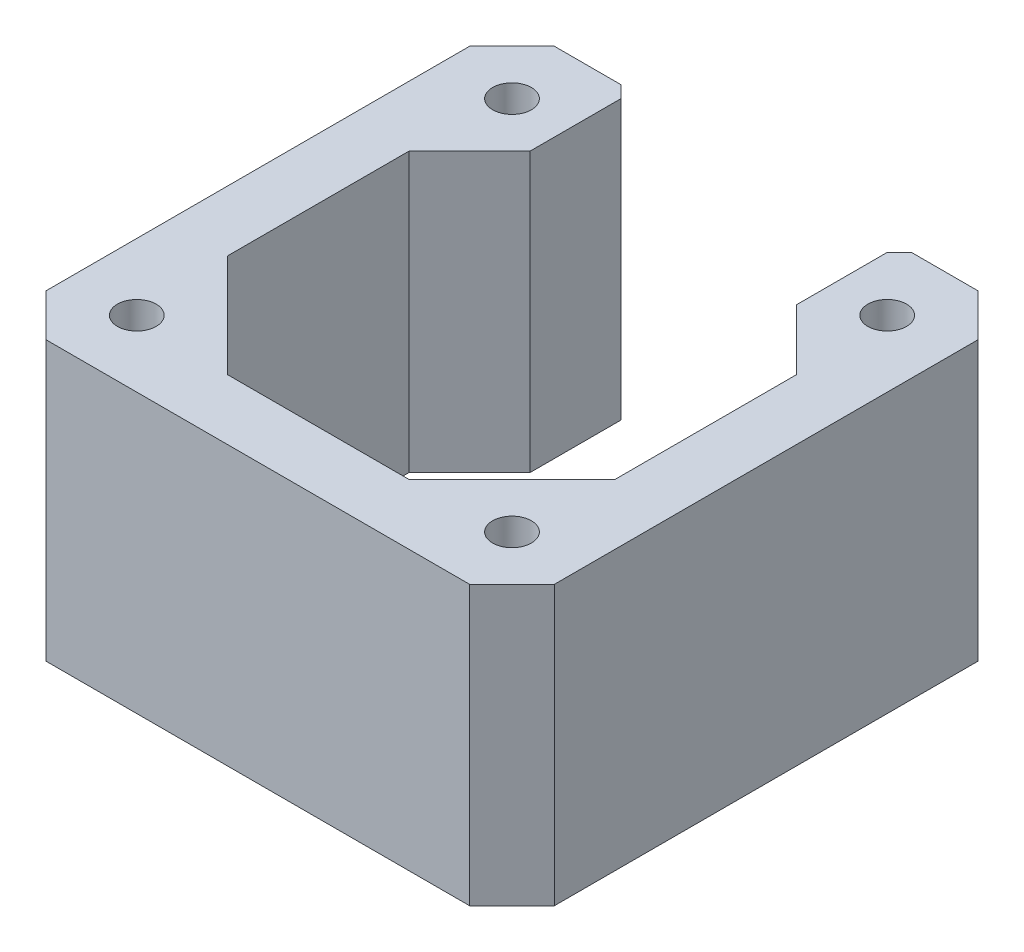
from build123d import *

# Parameters (mm, degrees)
BASE_DEPTH      = 23
BASE_DEPTH_BACK = 0.0001
SKETCH1_R       = 1.6


with BuildPart() as part:
    # Sketch1 → Base (new, two sides: drawn at the far end of the back side and taken through both)
    with BuildSketch(Plane(origin=(0, 0, 0), x_dir=(1, 0, 0), z_dir=(0, 1, 0)).offset(-BASE_DEPTH_BACK)):
        Polygon((-16, -7.499999998), (-7.5, -15.999999998), (7.5, -15.999999998), (16, -7.499999998), (16, 7.500000002), (10.999999997, 12.500000005), (11, 20.000000005), (12, 21.000000005), (17.500000004, 21.000000005), (21, 17.500000009), (21, -17.499999998), (17.5, -20.999999998), (-17.5, -20.999999998), (-21, -17.499999998), (-21, 17.500000009), (-17.500000004, 21.000000005), (-12, 21.000000005), (-11, 20.000000005), (-10.999999997, 12.500000005), (-16, 7.500000002), align=None)
        with Locations((-15.500000002, 15.5)):
            Circle(SKETCH1_R, mode=Mode.SUBTRACT)
        with Locations((-15.500000002, -15.5)):
            Circle(SKETCH1_R, mode=Mode.SUBTRACT)
        with Locations((15.500000002, -15.5)):
            Circle(SKETCH1_R, mode=Mode.SUBTRACT)
        with Locations((15.500000002, 15.5)):
            Circle(SKETCH1_R, mode=Mode.SUBTRACT)
    extrude(amount=BASE_DEPTH + BASE_DEPTH_BACK)


solid = part.part
